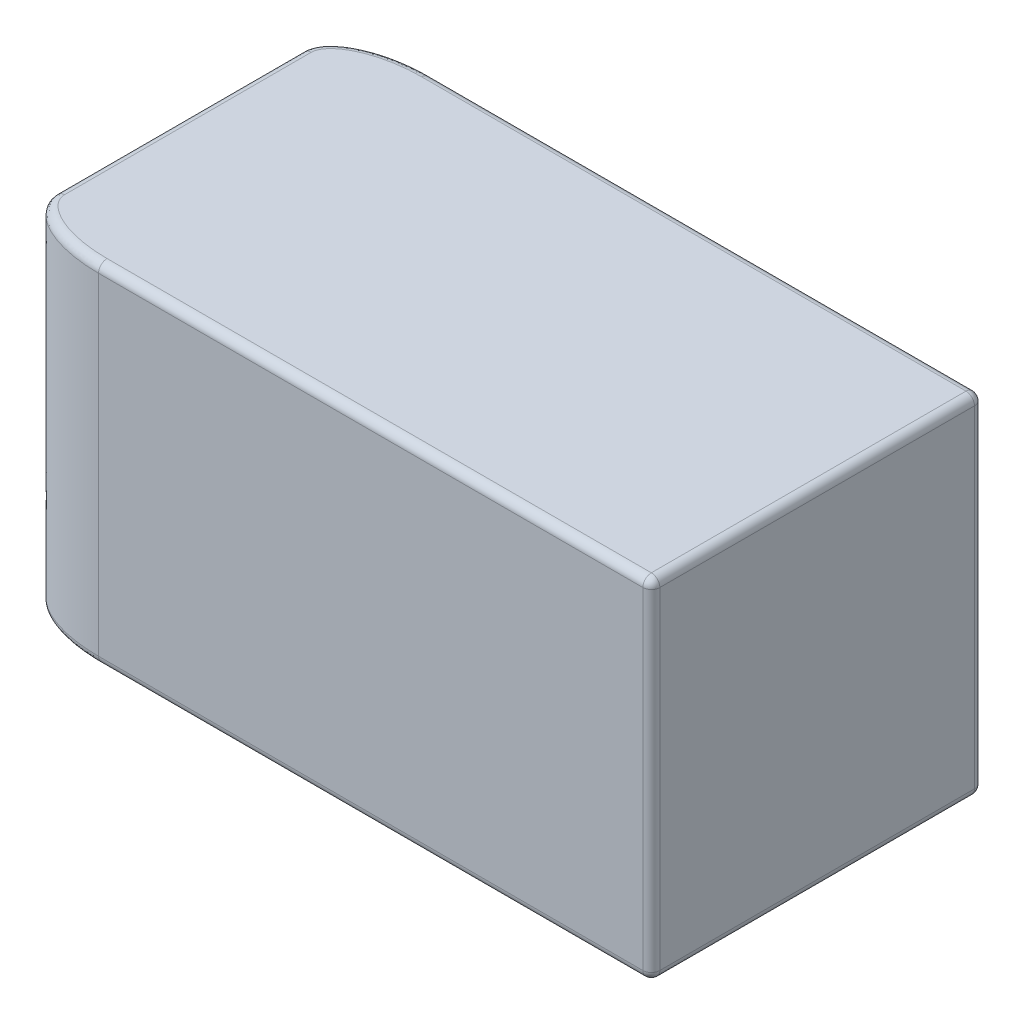
from build123d import *

# Parameters (mm, degrees)
SKETCH1_W           = 75
SKETCH1_H           = 39
BOSS_EXTRUDE1_DEPTH = 20.5
FILLET1_R           = 1
FILLET2_SIZE        = 5
FILLET2_SIZE_2      = 10
FILLET3_R           = 1


with BuildPart() as part:
    # Sketch1 → Boss-Extrude1 (new, symmetric)
    with BuildSketch(Plane(origin=(0, 0, 0), x_dir=(1, 0, 0), z_dir=(0, 1, 0))):
        Rectangle(SKETCH1_W, SKETCH1_H)
    extrude(amount=BOSS_EXTRUDE1_DEPTH, both=True)

    # Fillet1
    fillet1_edges = [part.edges().sort_by_distance(p)[0] for p in [
        (37.5, 0, 19.5),
        (37.5, 0, -19.5),
    ]]
    fillet(fillet1_edges, radius=FILLET1_R)

    # Fillet2
    # an asymmetric fillet: 10, 5 mm, written as the material it takes off along each edge
    with BuildSketch(Plane(origin=(-37.5, 45.5, -19.5), x_dir=(0, 0, 1), z_dir=(0, -1, 0))) as fillet2_piece_1:
        with BuildLine():
            Bezier((FILLET2_SIZE, 0), (0, 0), (0, -FILLET2_SIZE_2), weights=[1, 0.707106781, 1])
            Line((0, -FILLET2_SIZE_2), (0, 0))
            Line((0, 0), (FILLET2_SIZE, 0))
        make_face()
    extrude(amount=91, mode=Mode.SUBTRACT)
    with BuildSketch(Plane(origin=(-37.5, 45.5, 19.5), x_dir=(1, 0, 0), z_dir=(0, -1, 0))) as fillet2_piece_2:
        with BuildLine():
            Bezier((FILLET2_SIZE_2, 0), (0, 0), (0, -FILLET2_SIZE), weights=[1, 0.707106781, 1])
            Line((0, -FILLET2_SIZE), (0, 0))
            Line((0, 0), (FILLET2_SIZE_2, 0))
        make_face()
    extrude(amount=91, mode=Mode.SUBTRACT)

    # Fillet3
    fillet3_edges = [part.edges().sort_by_distance(p)[0] for p in [
        (-33.444718917, -20.5, 18.52058196),
        (-37.5, -20.5, 0),
        (-33.444718915, -20.5, -18.520581957),
        (4.5, -20.5, -19.5),
        (37.207106781, -20.5, -19.207106781),
        (37.5, -20.5, 0),
        (37.207106781, -20.5, 19.207106781),
        (-33.444718917, 20.5, 18.52058196),
        (-37.5, 20.5, 0),
        (-33.444718915, 20.5, -18.520581957),
        (4.5, 20.5, -19.5),
        (37.207106781, 20.5, -19.207106781),
        (37.5, 20.5, 0),
        (37.207106781, 20.5, 19.207106781),
        (4.5, -20.5, 19.5),
        (4.5, 20.5, 19.5),
    ]]
    fillet(fillet3_edges, radius=FILLET3_R)


solid = part.part
